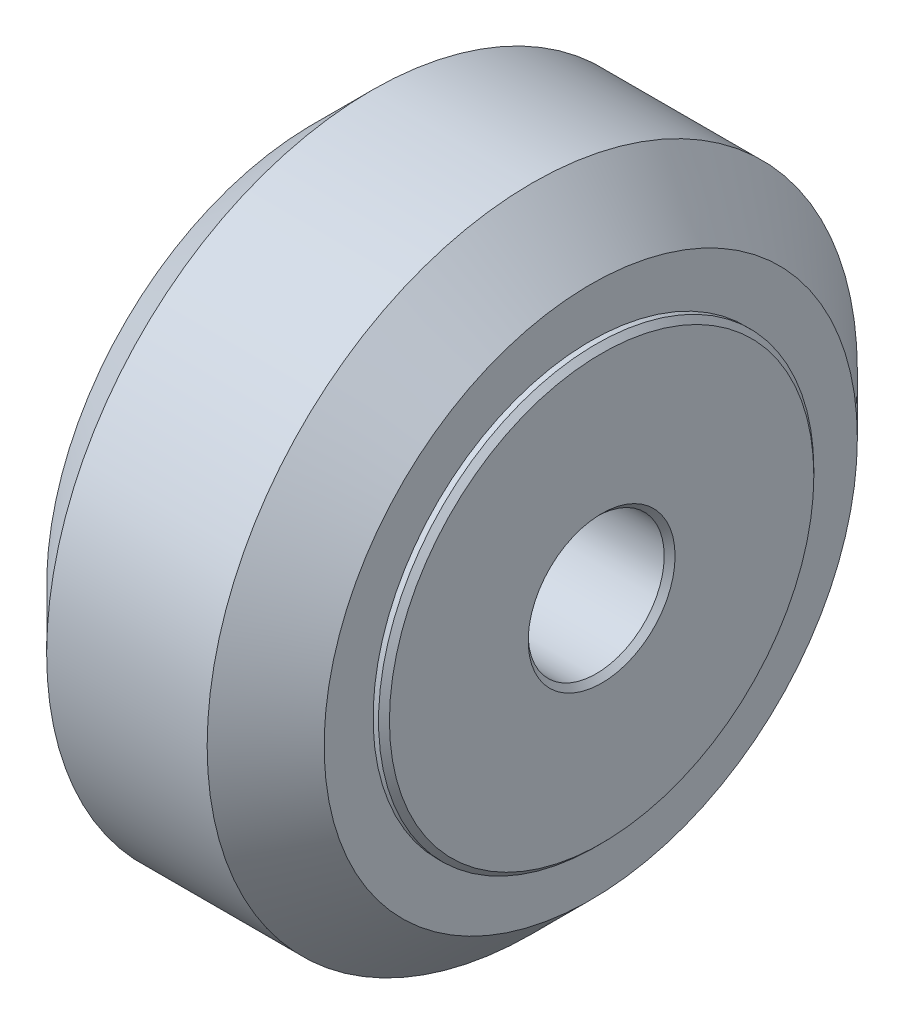
from build123d import *

# Parameters (mm, degrees)
SKETCH2_R           = 8
SKETCH2_R_2         = 2.5
BEARING_DEPTH       = 5
SKETCH3_R           = 5
SKETCH3_R_2         = 2.5
BOSS_EXTRUDE1_DEPTH = 0.5
SKETCH4_R           = 8
SKETCH4_R_2         = 2.5
BOSS_EXTRUDE2_DEPTH = 5
CHAMFER1_SIZE       = 0.2
CHAMFER2_SIZE       = 0.2


with BuildPart() as part:
    # Sketch1 → Revolve1 (revolve)
    with BuildSketch(Plane.XY):
        Polygon((-0.5, 8), (-0.5, 7), (0.5, 7), (0.5, 8), (5.1, 8), (5.1, 9.8), (2.95, 11.95), (-2.95, 11.95), (-5.1, 9.8), (-5.1, 8), align=None)
    revolve(axis=Axis((-5.1, 0, 0), (1, 0, 0)))


with BuildPart() as body_2:
    # Sketch2 → bearing (new body)
    with BuildSketch(Plane(origin=(0.5, 0, 0), x_dir=(0, 0, -1), z_dir=(1, 0, 0))):
        Circle(SKETCH2_R)
        Circle(SKETCH2_R_2, mode=Mode.SUBTRACT)
    extrude(amount=BEARING_DEPTH)

    # Chamfer1
    chamfer1_edges = [body_2.edges().sort_by_distance(p)[0] for p in [
        (5.5, 0, 8),
        (5.5, 0, 2.5),
    ]]
    chamfer(chamfer1_edges, length=CHAMFER1_SIZE)


with BuildPart() as body_3:
    # Sketch3 → Boss-Extrude1 (new, symmetric)
    with BuildSketch(Plane(origin=(0, 0, 0), x_dir=(0, 0, -1), z_dir=(1, 0, 0))):
        Circle(SKETCH3_R)
        Circle(SKETCH3_R_2, mode=Mode.SUBTRACT)
    extrude(amount=BOSS_EXTRUDE1_DEPTH, both=True)


with BuildPart() as body_4:
    # Sketch4 → Boss-Extrude2 (new body)
    with BuildSketch(Plane.ZY.offset(0.5)):
        Circle(SKETCH4_R)
        Circle(SKETCH4_R_2, mode=Mode.SUBTRACT)
    extrude(amount=BOSS_EXTRUDE2_DEPTH)

    # Chamfer2
    chamfer2_edges = [body_4.edges().sort_by_distance(p)[0] for p in [
        (-5.5, 0, -8),
        (-5.5, 0, -2.5),
    ]]
    chamfer(chamfer2_edges, length=CHAMFER2_SIZE)


solid = Compound([part.part, body_2.part, body_3.part, body_4.part])
